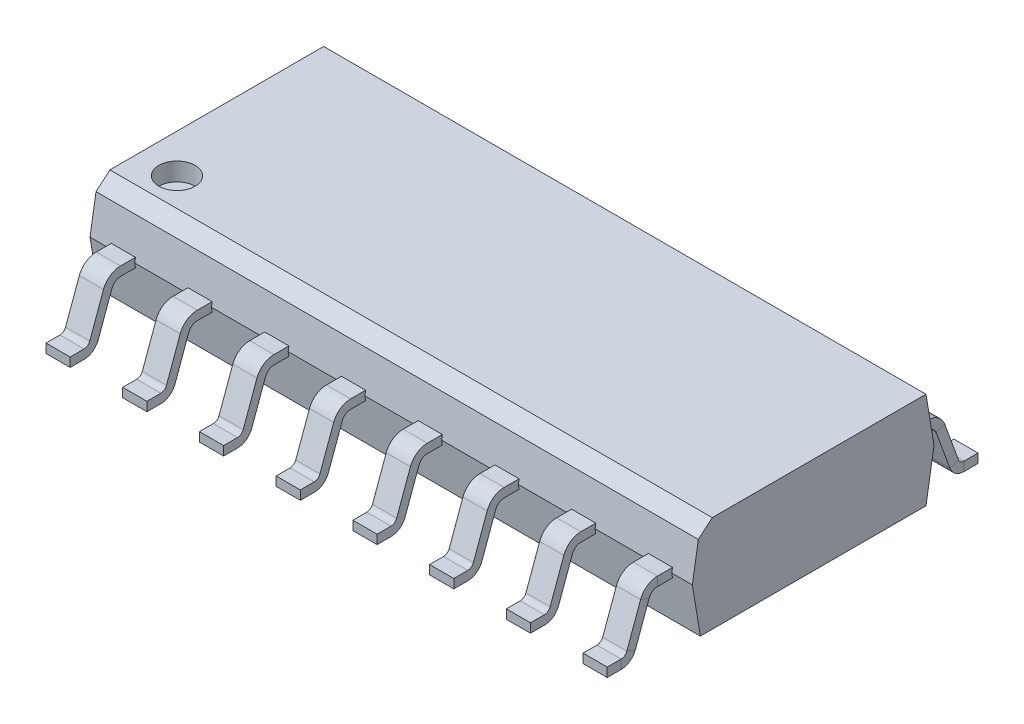
from build123d import *

# Parameters (mm, degrees)
SKETCH1_W               = 9.29
SKETCH1_H               = 4.47
BASE_FLANGE1_DEPTH      = 0.15
EDGE_FLANGE1_DEPTH      = 9.29
EDGE_FLANGE1_BEND_DEPTH = 9.29
EDGE_FLANGE2_START      = -4.645
EDGE_FLANGE2_DEPTH      = 9.29
EDGE_FLANGE2_2_DEPTH    = 9.29
SKETCH15_W              = 0.87
SKETCH15_H              = 1.568409632
EXTRUDE2_DEPTH          = 6.662986458
EXTRUDE3_DEPTH          = 4.985
EXTRUDE3_DEPTH_BACK     = 4.985
SKETCH18_R              = 0.3
EXTRUDE4_DEPTH          = 0.3
CHAMFER1_SIZE           = 0.2
CHAMFER1_SIZE2          = 0.197490484


# Read off the part's stored shape, not the designer's step: Edge-Flange2
# Sheet-metal steps are written as plain solids
with BuildPart() as part:
    # Sketch1 → Base-Flange1 (new body)
    with BuildSketch(Plane(origin=(0, 0, 0), x_dir=(1, 0, 0), z_dir=(0, 1, 0))):
        Rectangle(SKETCH1_W, SKETCH1_H)
    extrude(amount=BASE_FLANGE1_DEPTH)

    # Edge-Flange1 section (across the edge) → Edge-Flange1 (add)
    with BuildSketch(Plane(origin=(4.645, 0, 2.340031131), x_dir=(0, -0.34202014332567265, -0.939692620785907), z_dir=(-1, 0, 0))):
        with BuildLine():
            Line((-0.15, 0.105031131), (-0.15, 1))
            Line((-0.15, 1), (0, 1))
            Line((0, 1), (0, 0.105031131))
            ThreePointArc((0, 0.105031131), (0.027127193, 0.018994665), (0.098696979, -0.035922762))
            Line((0.098696979, -0.035922762), (0.047393957, -0.176876656))
            ThreePointArc((0.047393957, -0.176876656), (-0.095745613, -0.0670418), (-0.15, 0.105031131))
        make_face()
    extrude(amount=EDGE_FLANGE1_DEPTH)

    # Edge-Flange1 section 2 (across the edge) → Edge-Flange1 bend (add)
    with BuildSketch(Plane(origin=(-4.645, 0, -2.340031131), x_dir=(0, -0.34202014332567265, 0.939692620785907), z_dir=(1, 0, 0))):
        with BuildLine():
            Line((-0.15, 0.105031131), (-0.15, 1))
            Line((-0.15, 1), (0, 1))
            Line((0, 1), (0, 0.105031131))
            ThreePointArc((0, 0.105031131), (0.027127193, 0.018994665), (0.098696979, -0.035922762))
            Line((0.098696979, -0.035922762), (0.047393957, -0.176876656))
            ThreePointArc((0.047393957, -0.176876656), (-0.095745613, -0.0670418), (-0.15, 0.105031131))
        make_face()
    extrude(amount=EDGE_FLANGE1_BEND_DEPTH)

    # Edge-Flange2 outline → Edge-Flange2 (cut)
    with BuildSketch(Plane.YZ.offset(EDGE_FLANGE2_START)):
        with BuildLine():
            ThreePointArc((-0.723894635, 2.603507231), (-0.838600956, 2.68871261), (-0.887902242, 2.822827783))
            Line((-0.887902242, 2.822827783), (-0.888389599, 2.823005167))
            Line((-0.888389599, 2.823005167), (-0.939692621, 2.682051274))
            Line((-0.939692621, 2.682051274), (-0.723894635, 2.603507231))
        make_face()
        with BuildLine():
            Line((-0.888389599, -2.823005167), (-0.887902242, -2.822827783))
            ThreePointArc((-0.887902242, -2.822827783), (-0.838600956, -2.68871261), (-0.723894635, -2.603507231))
            Line((-0.723894635, -2.603507231), (-0.939692621, -2.682051274))
            Line((-0.939692621, -2.682051274), (-0.888389599, -2.823005167))
        make_face()
    extrude(amount=EDGE_FLANGE2_DEPTH, mode=Mode.SUBTRACT)

    # Edge-Flange2 2 outline → Edge-Flange2 2 (add)
    with BuildSketch(Plane.YZ.offset(EDGE_FLANGE2_START)):
        with BuildLine():
            Line((-0.888389599, 3.068409632), (-0.888389599, 2.838430386))
            ThreePointArc((-0.888389599, 2.838430386), (-0.88826773, 2.83062528), (-0.887902242, 2.822827783))
            Line((-0.887902242, 2.822827783), (-0.672591614, 2.744461124))
            ThreePointArc((-0.672591614, 2.744461124), (-0.720304804, 2.781072742), (-0.738389599, 2.838430386))
            Line((-0.738389599, 2.838430386), (-0.738389599, 3.068409632))
            Line((-0.738389599, 3.068409632), (-0.888389599, 3.068409632))
        make_face()
        with BuildLine():
            Line((-0.888389599, -2.838430386), (-0.888389599, -3.068409632))
            Line((-0.888389599, -3.068409632), (-0.738389599, -3.068409632))
            Line((-0.738389599, -3.068409632), (-0.738389599, -2.838430386))
            ThreePointArc((-0.738389599, -2.838430386), (-0.720304804, -2.781072742), (-0.672591614, -2.744461124))
            Line((-0.672591614, -2.744461124), (-0.887902242, -2.822827783))
            ThreePointArc((-0.887902242, -2.822827783), (-0.88826773, -2.83062528), (-0.888389599, -2.838430386))
        make_face()
    extrude(amount=EDGE_FLANGE2_2_DEPTH)

    # Sketch15 → Extrude2 (cut, through all)
    with BuildSketch(Plane(origin=(0, 0.15, 0), x_dir=(1, 0, 0), z_dir=(0, 1, 0))):
        with Locations((3.81, 2.284204816)):
            Rectangle(SKETCH15_W, SKETCH15_H)
        with Locations((-3.81, 2.284204816)):
            Rectangle(SKETCH15_W, SKETCH15_H)
        with Locations((-2.54, 2.284204816)):
            Rectangle(SKETCH15_W, SKETCH15_H)
        with Locations((-1.27, 2.284204816)):
            Rectangle(SKETCH15_W, SKETCH15_H)
        with Locations((0, 2.284204816)):
            Rectangle(SKETCH15_W, SKETCH15_H)
        with Locations((1.27, 2.284204816)):
            Rectangle(SKETCH15_W, SKETCH15_H)
        with Locations((2.54, 2.284204816)):
            Rectangle(SKETCH15_W, SKETCH15_H)
        with Locations((2.54, -2.284204816)):
            Rectangle(SKETCH15_W, SKETCH15_H)
        with Locations((1.27, -2.284204816)):
            Rectangle(SKETCH15_W, SKETCH15_H)
        with Locations((0, -2.284204816)):
            Rectangle(SKETCH15_W, SKETCH15_H)
        with Locations((-1.27, -2.284204816)):
            Rectangle(SKETCH15_W, SKETCH15_H)
        with Locations((-2.54, -2.284204816)):
            Rectangle(SKETCH15_W, SKETCH15_H)
        with Locations((-3.81, -2.284204816)):
            Rectangle(SKETCH15_W, SKETCH15_H)
        with Locations((3.81, -2.284204816)):
            Rectangle(SKETCH15_W, SKETCH15_H)
    extrude(amount=-EXTRUDE2_DEPTH, mode=Mode.SUBTRACT)


with BuildPart() as body_2:
    # Sketch19 → Extrude3 (new, two sides: drawn at the far end of the back side and taken through both)
    with BuildSketch(Plane(origin=(0, 0, 0), x_dir=(0, 0, -1), z_dir=(1, 0, 0)).offset(-EXTRUDE3_DEPTH_BACK)):
        Polygon((1.86775714, 0.875), (-1.86775714, 0.875), (-2, 0.075), (-1.86775714, -0.725), (1.86775714, -0.725), (2, 0.075), align=None)
    extrude(amount=EXTRUDE3_DEPTH + EXTRUDE3_DEPTH_BACK)

    # Sketch18 → Extrude4 (cut)
    with BuildSketch(Plane(origin=(0, 0.875, 0), x_dir=(1, 0, 0), z_dir=(0, 1, 0))):
        with Locations(Location((-4.345, -1.2, 0), (0, 0, 270))):
            Circle(SKETCH18_R)
    extrude(amount=-EXTRUDE4_DEPTH, mode=Mode.SUBTRACT)

    # Chamfer1
    chamfer1_edges = [body_2.edges().sort_by_distance(p)[0] for p in [
        (0, 0.875, 1.86775714),
    ]]
    chamfer1_side = [body_2.faces().sort_by_distance(p)[0] for p in [
        (0, 0.475, 1.93387857),
    ]]
    chamfer(chamfer1_edges, length=CHAMFER1_SIZE, length2=CHAMFER1_SIZE2, reference=chamfer1_side[0])


solid = Compound([part.part, body_2.part])
